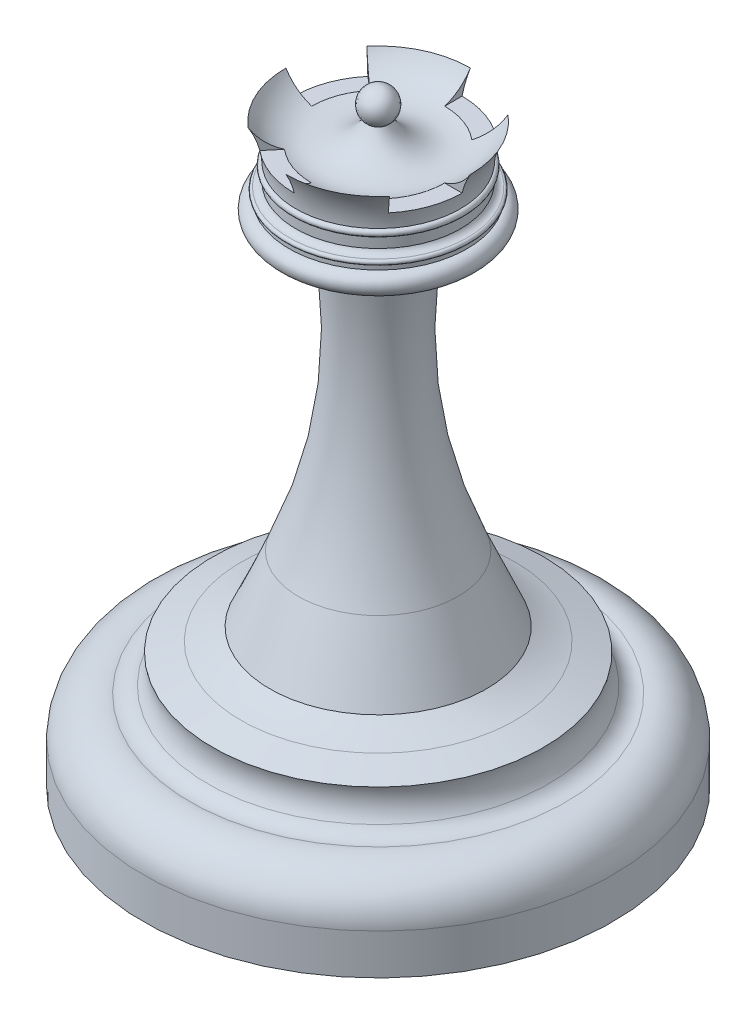
from build123d import *

# Parameters (mm, degrees)
CUT_REVOLVE2_ANGLE = 40
SKETCH5_W          = 3.764827906
SKETCH5_H          = 1.661475093
CUT_REVOLVE3_ANGLE = 40
SKETCH6_W          = 2.963332244
SKETCH6_H          = 1.467822958
CUT_REVOLVE4_ANGLE = 40
SKETCH7_W          = 3.915128769
SKETCH7_H          = 1.855725775
CUT_REVOLVE5_ANGLE = 40
CUT_EXTRUDE1_START = -0.4
SKETCH8_R          = 10
CUT_EXTRUDE1_DEPTH = 2


with BuildPart() as part:
    # Sketch1 → Revolve6 (revolve)
    with BuildSketch(Plane.XY):
        with BuildLine():
            Line((-11.6, 0), (0, 0))
            Line((0, 0), (0, 30))
            ThreePointArc((0, 30), (-0.755872106, 29.45940086), (-0.491541807, 28.568491457))
            ThreePointArc((-0.491541807, 28.568491457), (-2.49775228, 27.356530037), (-4.558415829, 28.473399181))
            ThreePointArc((-4.558415829, 28.473399181), (-4.193962712, 27.648795), (-4.067848204, 26.756106218))
            ThreePointArc((-4.067848204, 26.756106218), (-4.231561631, 26.592392792), (-4.067848204, 26.428679365))
            Line((-4.067848204, 26.428679365), (-4.067848204, 25.899516806))
            ThreePointArc((-4.067848204, 25.899516806), (-4.198852853, 25.740176883), (-4.396268259, 25.680355593))
            ThreePointArc((-4.396268259, 25.680355593), (-4.514980583, 25.561643268), (-4.396268259, 25.442930944))
            Line((-4.396268259, 25.442930944), (-4.396268259, 25.209959683))
            ThreePointArc((-4.396268259, 25.209959683), (-4.893328592, 24.712899349), (-4.396268259, 24.215839016))
            Line((-4.396268259, 24.215839016), (-2.441754013, 24.215839016))
            ThreePointArc((-2.441754013, 24.215839016), (-2.113693036, 17.042668395), (-3.942103069, 10.098684128))
            Line((-3.942103069, 10.098684128), (-5.351935578, 6.84647527))
            ThreePointArc((-5.351935578, 6.84647527), (-6.050342562, 6.495502918), (-6.77919191, 6.213133419))
            Line((-6.77919191, 6.213133419), (-8.17314169, 5.748741625))
            ThreePointArc((-8.17314169, 5.748741625), (-8.116093965, 5.000659599), (-8.418474704, 4.31403958))
            ThreePointArc((-8.418474704, 4.31403958), (-8.80494389, 4.023824232), (-9.2852566, 3.970129904))
            ThreePointArc((-9.2852566, 3.970129904), (-10.892332399, 3.51553242), (-11.59412509, 2))
            Line((-11.59412509, 2), (-11.6, 0))
        make_face()
    revolve(axis=Axis((0, 0, 0), (0, 1, 0)))

    # Sketch4 → Cut-Revolve2 (revolve, cut)
    with BuildSketch(Plane.XY):
        Polygon((-4.558415829, 29.379682507), (-6.573858898, 29.379682507), (-6.573858898, 27.473399181), (-2.54297276, 27.473399181), (-2.54297276, 29.379682507), align=None)
    revolve(axis=Axis((0, 0, 0), (0, -1, 0)), revolution_arc=CUT_REVOLVE2_ANGLE, mode=Mode.SUBTRACT)

    # Sketch5 → Cut-Revolve3 (revolve, cut)
    with BuildSketch(Plane.XY):
        with Locations((4.558415829, 28.304136728)):
            Rectangle(SKETCH5_W, SKETCH5_H)
    revolve(axis=Axis((0, 0, 0), (0, -1, 0)), revolution_arc=CUT_REVOLVE3_ANGLE, mode=Mode.SUBTRACT)

    # Sketch6 → Cut-Revolve4 (revolve, cut)
    with BuildSketch(Plane(origin=(0, 0, 0), x_dir=(0, 0, -1), z_dir=(1, 0, 0))):
        with Locations((4.558415829, 28.20731066)):
            Rectangle(SKETCH6_W, SKETCH6_H)
    revolve(axis=Axis((0, 0, 0), (0, -1, 0)), revolution_arc=CUT_REVOLVE4_ANGLE, mode=Mode.SUBTRACT)

    # Sketch7 → Cut-Revolve5 (revolve, cut)
    with BuildSketch(Plane(origin=(0, 0, 0), x_dir=(0, 0, -1), z_dir=(1, 0, 0))):
        with Locations((-4.537659291, 28.401262069)):
            Rectangle(SKETCH7_W, SKETCH7_H)
    revolve(axis=Axis((0, 0, 0), (0, -1, 0)), revolution_arc=CUT_REVOLVE5_ANGLE, mode=Mode.SUBTRACT)

    # Sketch8 → Cut-Extrude1 (cut)
    with BuildSketch(Plane.XZ.offset(CUT_EXTRUDE1_START)):
        Circle(SKETCH8_R)
    extrude(amount=-CUT_EXTRUDE1_DEPTH, mode=Mode.SUBTRACT)


solid = part.part
